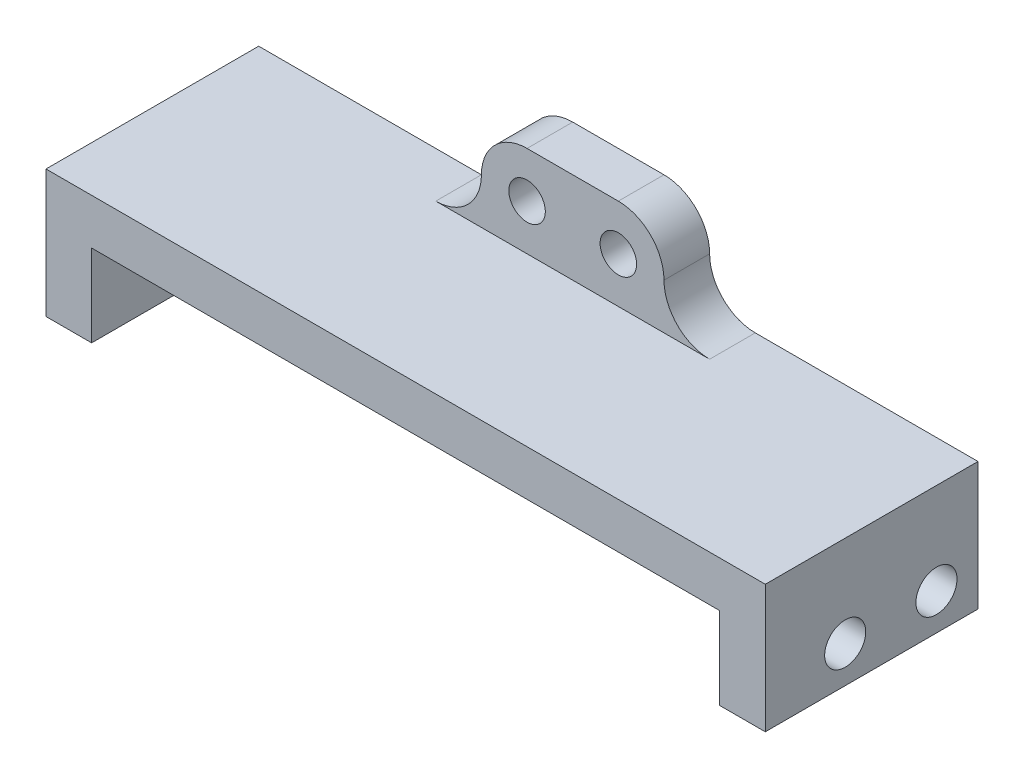
from build123d import *

# Parameters (mm, degrees)
BOSS_EXTRUDE1_DEPTH = 23.3
SKETCH2_W           = 20
SKETCH2_H           = 10
SKETCH2_R           = 2
BOSS_EXTRUDE2_DEPTH = 5
FILLET1_START       = -1
FILLET1_DEPTH       = 6
FILLET1_2_DEPTH     = 5
SKETCH3_R           = 2.25
CUT_EXTRUDE1_DEPTH  = 124


with BuildPart() as part:
    # Sketch1 → Boss-Extrude1 (new body)
    with BuildSketch(Plane.XY):
        Polygon((-39.4, -14), (-39.4, 0), (39.4, 0), (39.4, -14), (34.4, -14), (34.4, -5), (-34.4, -5), (-34.4, -14), align=None)
    extrude(amount=BOSS_EXTRUDE1_DEPTH)

    # Sketch2 → Boss-Extrude2 (add)
    with BuildSketch(Plane(origin=(0, 0, 0), x_dir=(-1, 0, 0), z_dir=(0, 0, -1))):
        with Locations((0, 5)):
            Rectangle(SKETCH2_W, SKETCH2_H)
        with Locations((5, 5)):
            Circle(SKETCH2_R, mode=Mode.SUBTRACT)
        with Locations(Location((-5, 5, 0), (0, 0, 180))):
            Circle(SKETCH2_R, mode=Mode.SUBTRACT)
    extrude(amount=-BOSS_EXTRUDE2_DEPTH)

    # Fillet1: read off the stored shape, not the designer's step
    # Fillet1 outline → Fillet1 (cut)
    with BuildSketch(Plane.XY.offset(FILLET1_START)):
        with BuildLine():
            Line((-10, 10), (-10, 5))
            ThreePointArc((-10, 5), (-8.535533906, 8.535533906), (-5, 10))
            Line((-5, 10), (-10, 10))
        make_face()
        with BuildLine():
            Line((10, 10), (5, 10))
            ThreePointArc((5, 10), (8.535533906, 8.535533906), (10, 5))
            Line((10, 5), (10, 10))
        make_face()
    extrude(amount=FILLET1_DEPTH, mode=Mode.SUBTRACT)

    # Fillet1 2 outline → Fillet1 2 (add)
    with BuildSketch(Plane.XY):
        with BuildLine():
            Line((-10, 0), (-10, 5))
            ThreePointArc((-10, 5), (-11.464466094, 1.464466094), (-15, 0))
            Line((-15, 0), (-10, 0))
        make_face()
        with BuildLine():
            Line((10, 5), (10, 0))
            Line((10, 0), (15, 0))
            ThreePointArc((15, 0), (11.464466094, 1.464466094), (10, 5))
        make_face()
    extrude(amount=FILLET1_2_DEPTH)

    # Sketch3 → Cut-Extrude1 (cut)
    with BuildSketch(Plane(origin=(39.4, 0, 0), x_dir=(0, 0, -1), z_dir=(1, 0, 0))):
        with Locations((-4.55, -10)):
            Circle(SKETCH3_R)
        with Locations((-14.55, -10)):
            Circle(SKETCH3_R)
    extrude(amount=-CUT_EXTRUDE1_DEPTH, mode=Mode.SUBTRACT)


solid = part.part
